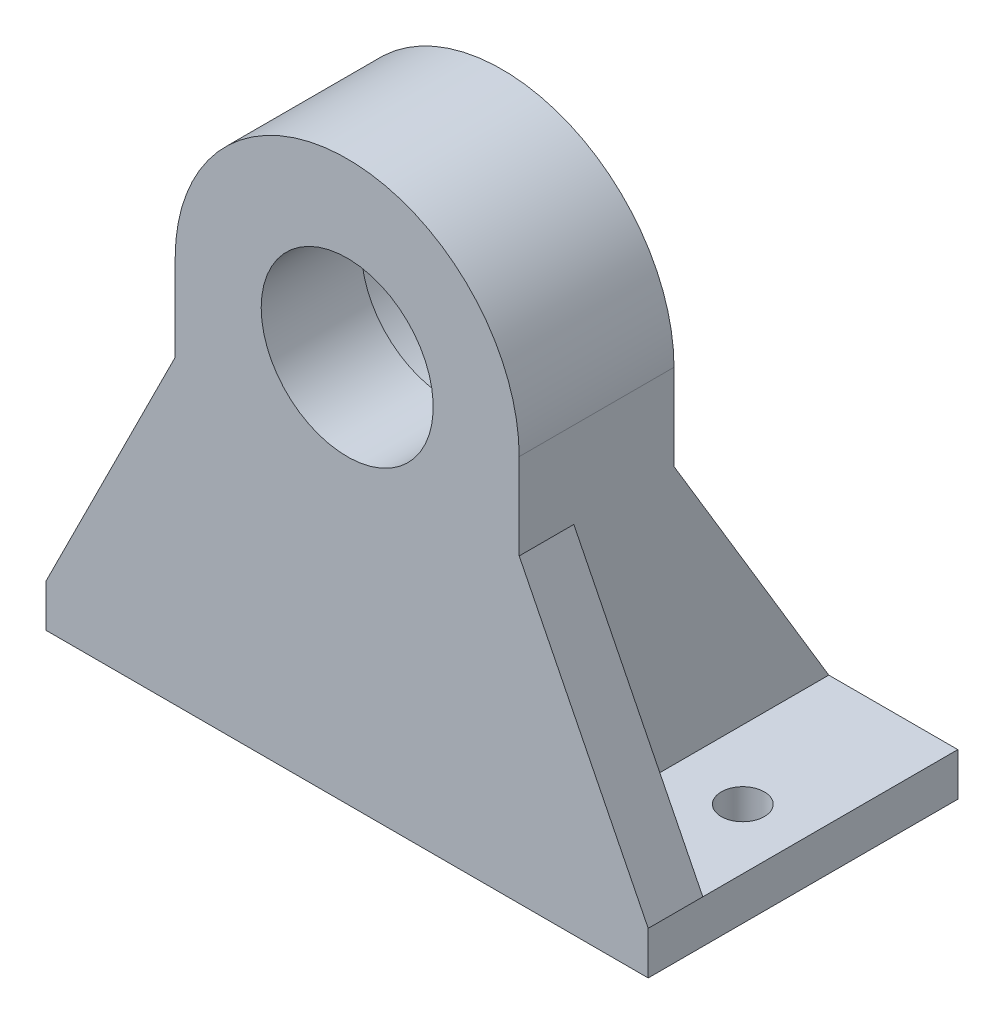
from build123d import *

# Parameters (mm, degrees)
BOSS_EXTRUDE1_DEPTH = 18
SKETCH6_W           = 70
SKETCH6_H           = 36
SKETCH6_R           = 2.5
BOSS_EXTRUDE2_DEPTH = 5
SKETCH7_R           = 10
CUT_EXTRUDE1_DEPTH  = 60.782940711
SKETCH8_R           = 14.2875
CUT_EXTRUDE2_DEPTH  = 6.35
CHAMFER1_SIZE       = 0.5
BOSS_EXTRUDE3_DEPTH = 6.35
BOSS_EXTRUDE4_DEPTH = 6.35


with BuildPart() as part:
    # Sketch3 → Boss-Extrude1 (new body)
    with BuildSketch(Plane.XY):
        with BuildLine():
            Line((-20, 0), (-20, -40))
            Line((-20, -40), (20, -40))
            Line((20, -40), (20, 0))
            ThreePointArc((20, 0), (0, 20), (-20, 0))
        make_face()
    extrude(amount=BOSS_EXTRUDE1_DEPTH)

    # Sketch6 → Boss-Extrude2 (add)
    with BuildSketch(Plane.XZ.offset(40)):
        Rectangle(SKETCH6_W, SKETCH6_H)
        with Locations((28, 0)):
            Circle(SKETCH6_R, mode=Mode.SUBTRACT)
        with Locations((-28, 0)):
            Circle(SKETCH6_R, mode=Mode.SUBTRACT)
    extrude(amount=BOSS_EXTRUDE2_DEPTH)

    # Sketch7 → Cut-Extrude1 (cut, through all)
    with BuildSketch(Plane(origin=(0, 0, 0), x_dir=(-1, 0, 0), z_dir=(0, 0, -1))):
        Circle(SKETCH7_R)
    extrude(amount=-CUT_EXTRUDE1_DEPTH, mode=Mode.SUBTRACT)

    # Sketch8 → Cut-Extrude2 (cut)
    with BuildSketch(Plane(origin=(0, 0, 0), x_dir=(-1, 0, 0), z_dir=(0, 0, -1))):
        Circle(SKETCH8_R)
    extrude(amount=-CUT_EXTRUDE2_DEPTH, mode=Mode.SUBTRACT)

    # Chamfer1
    chamfer1_edges = [part.edges().sort_by_distance(p)[0] for p in [
        (14.2875, 0, 0),
    ]]
    chamfer(chamfer1_edges, length=CHAMFER1_SIZE)

    # Sketch9 → Boss-Extrude3 (add)
    with BuildSketch(Plane(origin=(20, 0, 0), x_dir=(0, 0, -1), z_dir=(1, 0, 0))):
        Polygon((18, -40), (0, -10), (0, -40), align=None)
    boss_extrude3 = extrude(amount=-BOSS_EXTRUDE3_DEPTH)

    # Mirror1: Boss-Extrude3 across plane
    add(boss_extrude3.mirror(Plane(origin=(0, 0, 0), x_dir=(0, 0, 1), z_dir=(1, 0, 0))))

    # Sketch10 → Boss-Extrude4 (add)
    with BuildSketch(Plane.XY.offset(18)):
        Polygon((-20, -10), (-35, -40), (-20, -40), align=None)
        Polygon((20, -10), (20, -40), (35, -40), align=None)
    extrude(amount=-BOSS_EXTRUDE4_DEPTH)


solid = part.part
